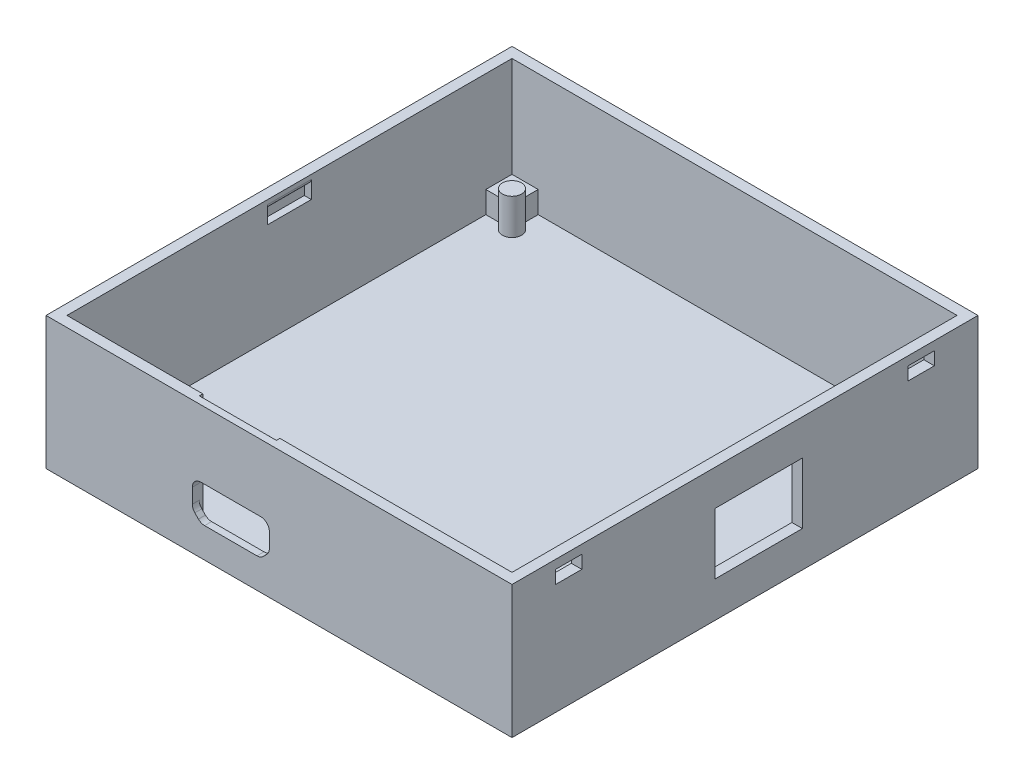
from build123d import *

# Parameters (mm, degrees)
SKETCH1_W           = 51
SKETCH1_H           = 51
BOSS_EXTRUDE1_DEPTH = 14
SHELL1_T            = 1.2
CUT_EXTRUDE1_REACH  = 63.323
SKETCH3_W           = 8.833103678
SKETCH3_H           = 4.102185467
FILLET1_R           = 1
CHAMFER1_SIZE       = 1
FILLET2_R           = 1
BOSS_EXTRUDE2_DEPTH = 2.5
SKETCH4_3_R         = 1.09999934
BOSS_EXTRUDE3_DEPTH = 4.1
CUT_EXTRUDE3_REACH  = 63.323
SKETCH8_W           = 3
SKETCH8_H           = 1.5
FILLET3_R           = 1
SKETCH9_W           = 5
SKETCH9_H           = 1.5
CUT_EXTRUDE4_DEPTH  = 0.8
FILLET4_R           = 0.5
CUT_EXTRUDE5_REACH  = 63.323
SKETCH10_W          = 10
SKETCH10_H          = 7.000137798
SKETCH14_W          = 8.833103678
SKETCH14_H          = 0.4
CUT_EXTRUDE6_DEPTH  = 13


# Read off the part's stored shape, not the designer's step: Boss-Extrude2
with BuildPart() as part:
    # Sketch1 → Boss-Extrude1 (new body)
    with BuildSketch(Plane(origin=(0, 0, 0), x_dir=(1, 0, 0), z_dir=(0, 1, 0))):
        Rectangle(SKETCH1_W, SKETCH1_H)
    extrude(amount=BOSS_EXTRUDE1_DEPTH)

    # Shell1
    shell1_openings = [part.faces().sort_by_distance(p)[0] for p in [
        (0, 14, 0),
    ]]
    offset(amount=SHELL1_T, openings=shell1_openings, kind=Kind.INTERSECTION)

    # Sketch3 → Cut-Extrude1 (cut, up to next)
    with BuildSketch(Plane.XY.offset(26.7), mode=Mode.PRIVATE) as cut_extrude1_sk1:
        with Locations((-5.520237079, 4.278939715)):
            Rectangle(SKETCH3_W, SKETCH3_H)
    cut_extrude1_tool1 = extrude(cut_extrude1_sk1.sketch, amount=-CUT_EXTRUDE1_REACH, mode=Mode.PRIVATE) & part.part
    add(cut_extrude1_tool1.solids().sort_by_distance((-5.520237, 4.27894, 26.7))[0], mode=Mode.SUBTRACT)

    # Fillet1
    fillet1_edges = [part.edges().sort_by_distance(p)[0] for p in [
        (-1.10368524, 6.330032448, 26.1),
        (-9.936788918, 6.330032448, 26.1),
    ]]
    fillet(fillet1_edges, radius=FILLET1_R)

    # Chamfer1
    chamfer1_edges = [part.edges().sort_by_distance(p)[0] for p in [
        (-1.10368524, 2.227846981, 26.1),
        (-9.936788918, 2.227846981, 26.1),
    ]]
    chamfer(chamfer1_edges, length=CHAMFER1_SIZE)

    # Fillet2
    fillet2_edges = [part.edges().sort_by_distance(p)[0] for p in [
        (-1.10368524, 3.227846981, 26.1),
        (-8.936788918, 2.227846981, 26.1),
        (-2.10368524, 2.227846981, 26.1),
        (-9.936788918, 3.227846981, 26.1),
    ]]
    fillet(fillet2_edges, radius=FILLET2_R)

    # Boss-Extrude2 outline → Boss-Extrude2 (add)
    with BuildSketch(Plane(origin=(0, 0, 0), x_dir=(1, 0, 0), z_dir=(0, 1, 0))):
        with BuildLine():
            Line((25.5, 25.5), (22.50000961, 25.5))
            Line((22.50000961, 25.5), (22.50000961, 23.60000133))
            ThreePointArc((22.50000961, 23.60000133), (23.277821677, 23.277816289), (23.60000133, 22.50000199))
            Line((23.60000133, 22.50000199), (25.5, 22.50000199))
            Line((25.5, 22.50000199), (25.5, 25.5))
        make_face()
        with BuildLine():
            Line((-22.50000961, 23.60000133), (-22.50000961, 25.5))
            Line((-22.50000961, 25.5), (-25.5, 25.5))
            Line((-25.5, 25.5), (-25.5, 22.50000199))
            Line((-25.5, 22.50000199), (-23.60000895, 22.50000199))
            ThreePointArc((-23.60000895, 22.50000199), (-23.277826603, 23.277818983), (-22.50000961, 23.60000133))
        make_face()
        with BuildLine():
            Line((25.5, -25.5), (25.5, -22.50000199))
            Line((25.5, -22.50000199), (23.60000133, -22.50000199))
            ThreePointArc((23.60000133, -22.50000199), (23.277824371, -23.277821214), (22.50000961, -23.60000895))
            Line((22.50000961, -23.60000895), (22.50000961, -25.5))
            Line((22.50000961, -25.5), (25.5, -25.5))
        make_face()
        with BuildLine():
            Line((-23.60000895, -22.50000199), (-25.5, -22.50000199))
            Line((-25.5, -22.50000199), (-25.5, -25.5))
            Line((-25.5, -25.5), (-22.50000961, -25.5))
            Line((-22.50000961, -25.5), (-22.50000961, -23.60000895))
            ThreePointArc((-22.50000961, -23.60000895), (-23.277829297, -23.277823909), (-23.60000895, -22.50000199))
        make_face()
    extrude(amount=BOSS_EXTRUDE2_DEPTH)

    # Sketch4<3> → Boss-Extrude3 (add)
    with BuildSketch(Plane(origin=(0, 0, 0), x_dir=(1, 0, 0), z_dir=(0, 1, 0))):
        with Locations(Location((-22.50000961, 22.50000199, 0), (0, 0, 90))):
            Circle(SKETCH4_3_R)
        with Locations(Location((22.50000199, 22.50000199, 0), (0, 0, 89.999603096))):
            Circle(SKETCH4_3_R)
        with Locations(Location((22.50000199, -22.50000961, 0), (0, 0, 0.000396902))):
            Circle(SKETCH4_3_R)
        with Locations(Location((-22.50000961, -22.50000961, 0), (0, 0, 270))):
            Circle(SKETCH4_3_R)
    extrude(amount=BOSS_EXTRUDE3_DEPTH)

    # Sketch8 → Cut-Extrude3 (cut, up to next)
    with BuildSketch(Plane(origin=(26.7, 0, 0), x_dir=(0, 0, -1), z_dir=(1, 0, 0)), mode=Mode.PRIVATE) as cut_extrude3_sk1:
        with Locations((-20.2, 12.25)):
            Rectangle(SKETCH8_W, SKETCH8_H)
    cut_extrude3_tool1 = extrude(cut_extrude3_sk1.sketch, amount=-CUT_EXTRUDE3_REACH, mode=Mode.PRIVATE) & part.part
    # Sketch8 → Cut-Extrude3 (cut, up to next)
    with BuildSketch(Plane(origin=(26.7, 0, 0), x_dir=(0, 0, -1), z_dir=(1, 0, 0)), mode=Mode.PRIVATE) as cut_extrude3_sk2:
        with Locations((20.2, 12.25)):
            Rectangle(SKETCH8_W, SKETCH8_H)
    cut_extrude3_tool2 = extrude(cut_extrude3_sk2.sketch, amount=-CUT_EXTRUDE3_REACH, mode=Mode.PRIVATE) & part.part
    add(cut_extrude3_tool1.solids().sort_by_distance((26.7, 12.25, 20.2))[0], mode=Mode.SUBTRACT)
    add(cut_extrude3_tool2.solids().sort_by_distance((26.7, 12.25, -20.2))[0], mode=Mode.SUBTRACT)

    # Fillet3
    fillet3_edges = [part.edges().sort_by_distance(p)[0] for p in [
        (25.5, 13, 20.2),
        (25.5, 13, -20.2),
    ]]
    fillet(fillet3_edges, radius=FILLET3_R - 0.0001)  # a hair under: the kernel refuses the full size

    # Sketch9 → Cut-Extrude4 (cut)
    with BuildSketch(Plane(origin=(-25.5, 0, 0), x_dir=(0, 0, -1), z_dir=(1, 0, 0))):
        with Locations((0, 12.25)):
            Rectangle(SKETCH9_W, SKETCH9_H)
    extrude(amount=-CUT_EXTRUDE4_DEPTH, mode=Mode.SUBTRACT)

    # Fillet4
    fillet4_edges = [part.edges().sort_by_distance(p)[0] for p in [
        (-25.5, 13, 0),
    ]]
    fillet(fillet4_edges, radius=FILLET4_R)

    # Sketch10 → Cut-Extrude5 (cut, up to next)
    with BuildSketch(Plane(origin=(26.7, 0, 0), x_dir=(0, 0, -1), z_dir=(1, 0, 0)), mode=Mode.PRIVATE) as cut_extrude5_sk1:
        with Locations((1.575065653, 6.411548449)):
            Rectangle(SKETCH10_W, SKETCH10_H)
    cut_extrude5_tool1 = extrude(cut_extrude5_sk1.sketch, amount=-CUT_EXTRUDE5_REACH, mode=Mode.PRIVATE) & part.part
    add(cut_extrude5_tool1.solids().sort_by_distance((26.7, 6.411548, -1.575066))[0], mode=Mode.SUBTRACT)

    # Sketch14 → Cut-Extrude6 (cut)
    with BuildSketch(Plane(origin=(0, 14, 0), x_dir=(1, 0, 0), z_dir=(0, 1, 0))):
        with Locations((-5.520237079, -25.7)):
            Rectangle(SKETCH14_W, SKETCH14_H)
    extrude(amount=-CUT_EXTRUDE6_DEPTH, mode=Mode.SUBTRACT)


solid = part.part
